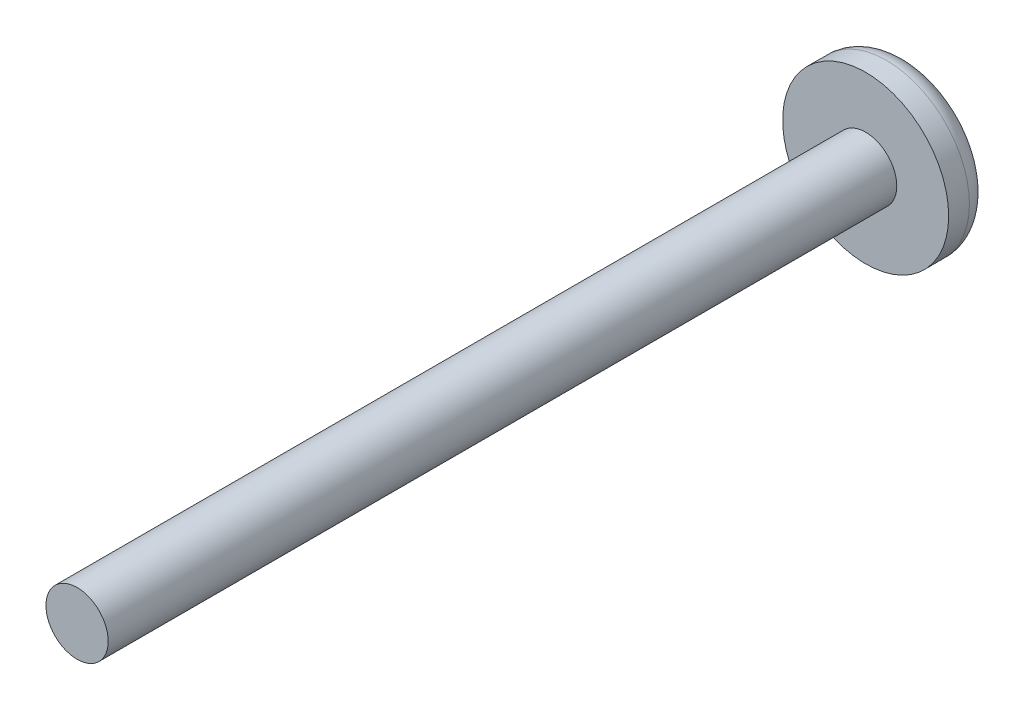
from build123d import *

# Parameters (mm, degrees)
FILLET1_R = 1


with BuildPart() as part:
    # Sketch1 → Revolve1 (revolve)
    with BuildSketch(Plane(origin=(0, 0, 0), x_dir=(1, 0, 0), z_dir=(0, 1, 0))):
        Polygon((0, 0), (0, 40), (4, 40), (4, 38), (1.5, 38), (1.5, 0), align=None)
    revolve(axis=Axis((0, 0, 0), (0, 0, -1)))

    # Fillet1
    fillet1_edges = [part.edges().sort_by_distance(p)[0] for p in [
        (-4, 0, -40),
    ]]
    fillet(fillet1_edges, radius=FILLET1_R)


solid = part.part
